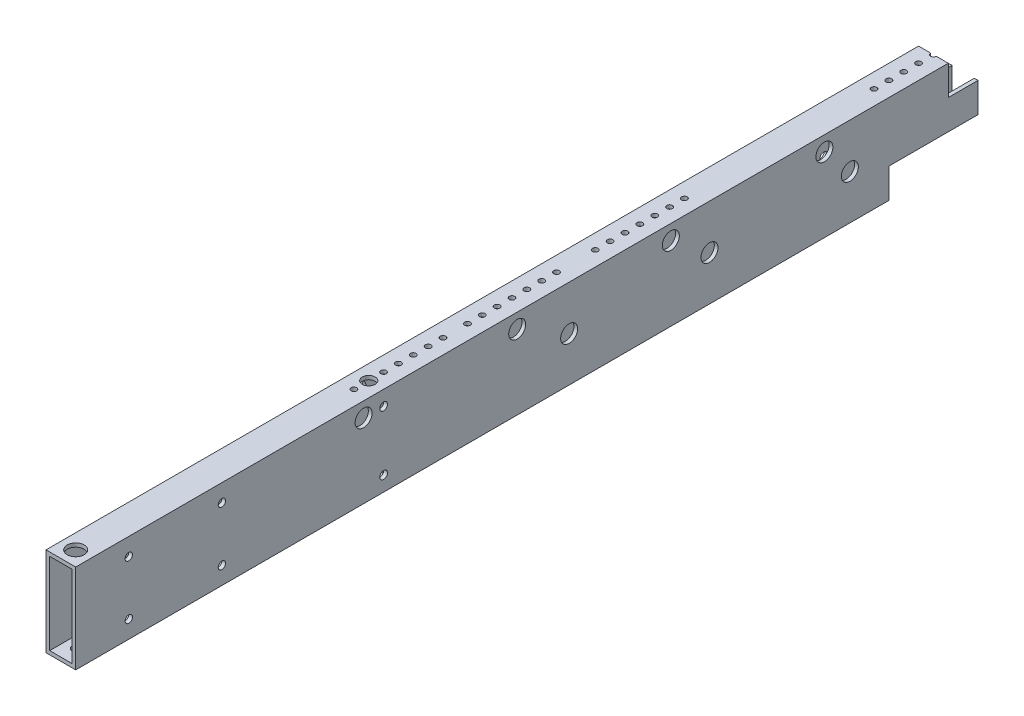
from build123d import *

# Parameters (mm, degrees)
SKETCH1_W                                           = 25.4
SKETCH1_H                                           = 76.2
BOSS_EXTRUDE1_DEPTH                                 = 385.699
SHELL1_T                                            = -3.175
SKETCH2_W                                           = 76.2
SKETCH2_H                                           = 25.4
CUT_EXTRUDE1_DEPTH                                  = 389.407632007
SKETCH3_W                                           = 25.4
SKETCH3_H                                           = 25.4
CUT_EXTRUDE2_DEPTH                                  = 389.407632007
SKETCH4_R                                           = 2.38125
CUT_EXTRUDE3_DEPTH                                  = 394.359185225
CUT_EXTRUDE4_REACH                                  = 395.359
SKETCH5_R                                           = 2.38125
CUT_EXTRUDE5_REACH                                  = 395.359
SKETCH6_R                                           = 2.38125
CBORE_FOR_M6_HEX_HEAD_BOLT1_D                       = 6.3
CBORE_FOR_M6_HEX_HEAD_BOLT1_CBORE_D                 = 14.547
CBORE_FOR_M6_HEX_HEAD_BOLT1_CBORE_DEPTH             = 4
CBORE_FOR_M6_HEX_HEAD_CAP_SCREW1_D                  = 6.6
CBORE_FOR_M6_HEX_HEAD_CAP_SCREW1_CBORE_D            = 14.55
CBORE_FOR_M6_HEX_HEAD_CAP_SCREW1_CBORE_DEPTH        = 4.15
CBORE_FOR_M6_HEX_HEAD_CAP_SCREW2_D                  = 6.6
CBORE_FOR_M6_HEX_HEAD_CAP_SCREW2_CBORE_D            = 14.55
CBORE_FOR_M6_HEX_HEAD_CAP_SCREW2_CBORE_DEPTH        = 4.15
CBORE_FOR_M6_HEX_HEAD_CAP_SCREW3_D                  = 6.6
CBORE_FOR_M6_HEX_HEAD_CAP_SCREW3_CBORE_D            = 14.55
CBORE_FOR_M6_HEX_HEAD_CAP_SCREW3_CBORE_DEPTH        = 4.15
CBORE_FOR_M6_HEX_HEAD_BOLT2_D                       = 6.3
CBORE_FOR_M6_HEX_HEAD_BOLT2_CBORE_D                 = 14.547
CBORE_FOR_M6_HEX_HEAD_BOLT2_CBORE_DEPTH             = 4
CBORE_FOR_M6_HEX_SOCKET_HEAD_CAP_SCREW1_D           = 6.4
CBORE_FOR_M6_HEX_SOCKET_HEAD_CAP_SCREW1_CBORE_D     = 11
CBORE_FOR_M6_HEX_SOCKET_HEAD_CAP_SCREW1_CBORE_DEPTH = 7


with BuildPart() as part:
    # Sketch1 → Boss-Extrude1 (new, symmetric)
    with BuildSketch(Plane.XY):
        Rectangle(SKETCH1_W, SKETCH1_H)
    extrude(amount=BOSS_EXTRUDE1_DEPTH, both=True)

    # Shell1
    shell1_openings = [part.faces().sort_by_distance(p)[0] for p in [
        (0, 0, -385.699),
        (0, 0, 385.699),
    ]]
    offset(amount=SHELL1_T, openings=shell1_openings, kind=Kind.INTERSECTION)

    # Sketch2 → Cut-Extrude1 (cut, through all)
    with BuildSketch(Plane(origin=(12.7, 0, 0), x_dir=(0, 0, -1), z_dir=(1, 0, 0))):
        with Locations((347.599, -25.4)):
            Rectangle(SKETCH2_W, SKETCH2_H)
    extrude(amount=-CUT_EXTRUDE1_DEPTH, mode=Mode.SUBTRACT)

    # Sketch3 → Cut-Extrude2 (cut, through all)
    with BuildSketch(Plane(origin=(12.7, 0, 0), x_dir=(0, 0, -1), z_dir=(1, 0, 0))):
        with Locations((372.999, 25.4)):
            Rectangle(SKETCH3_W, SKETCH3_H)
    extrude(amount=-CUT_EXTRUDE2_DEPTH, mode=Mode.SUBTRACT)

    # Sketch4 → Cut-Extrude3 (cut, through all)
    with BuildSketch(Plane(origin=(0, 38.1, 0), x_dir=(1, 0, 0), z_dir=(0, 1, 0))):
        with Locations((0, 147.394483214)):
            Circle(SKETCH4_R)
        with Locations((0, 134.694483214)):
            Circle(SKETCH4_R)
        with Locations((0, 121.994483214)):
            Circle(SKETCH4_R)
        with Locations((0, 109.294483214)):
            Circle(SKETCH4_R)
        with Locations((0, 96.594483214)):
            Circle(SKETCH4_R)
        with Locations((0, 83.894483214)):
            Circle(SKETCH4_R)
        with Locations((0, 71.194483214)):
            Circle(SKETCH4_R)
        with Locations((0, 38.09873)):
            Circle(SKETCH4_R)
        with Locations((0, 25.39873)):
            Circle(SKETCH4_R)
        with Locations((0, 12.69873)):
            Circle(SKETCH4_R)
        with Locations((0, -0.00127)):
            Circle(SKETCH4_R)
        with Locations((0, -12.70127)):
            Circle(SKETCH4_R)
        with Locations((0, -25.40127)):
            Circle(SKETCH4_R)
        with Locations((0, -38.10127)):
            Circle(SKETCH4_R)
        with Locations((0, -58.99324371)):
            Circle(SKETCH4_R)
        with Locations((0, -71.69324371)):
            Circle(SKETCH4_R)
        with Locations((0, -84.39324371)):
            Circle(SKETCH4_R)
        with Locations((0, -97.09324371)):
            Circle(SKETCH4_R)
        with Locations((0, -109.79324371)):
            Circle(SKETCH4_R)
        with Locations((0, -122.49324371)):
            Circle(SKETCH4_R)
        with Locations((0, -135.19324371)):
            Circle(SKETCH4_R)
    extrude(amount=-CUT_EXTRUDE3_DEPTH, mode=Mode.SUBTRACT)

    # Sketch5 → Cut-Extrude4 (cut, up to next)
    with BuildSketch(Plane(origin=(0, 38.1, 0), x_dir=(1, 0, 0), z_dir=(0, 1, 0)), mode=Mode.PRIVATE) as cut_extrude4_sk1:
        with Locations((0, 360.299)):
            Circle(SKETCH5_R)
    cut_extrude4_tool1 = extrude(cut_extrude4_sk1.sketch, amount=-CUT_EXTRUDE4_REACH, mode=Mode.PRIVATE) & part.part
    # Sketch5 → Cut-Extrude4 (cut, up to next)
    with BuildSketch(Plane(origin=(0, 38.1, 0), x_dir=(1, 0, 0), z_dir=(0, 1, 0)), mode=Mode.PRIVATE) as cut_extrude4_sk2:
        with Locations((0, 347.599)):
            Circle(SKETCH5_R)
    cut_extrude4_tool2 = extrude(cut_extrude4_sk2.sketch, amount=-CUT_EXTRUDE4_REACH, mode=Mode.PRIVATE) & part.part
    # Sketch5 → Cut-Extrude4 (cut, up to next)
    with BuildSketch(Plane(origin=(0, 38.1, 0), x_dir=(1, 0, 0), z_dir=(0, 1, 0)), mode=Mode.PRIVATE) as cut_extrude4_sk3:
        with Locations((0, 334.899)):
            Circle(SKETCH5_R)
    cut_extrude4_tool3 = extrude(cut_extrude4_sk3.sketch, amount=-CUT_EXTRUDE4_REACH, mode=Mode.PRIVATE) & part.part
    # Sketch5 → Cut-Extrude4 (cut, up to next)
    with BuildSketch(Plane(origin=(0, 38.1, 0), x_dir=(1, 0, 0), z_dir=(0, 1, 0)), mode=Mode.PRIVATE) as cut_extrude4_sk4:
        with Locations((0, 322.199)):
            Circle(SKETCH5_R)
    cut_extrude4_tool4 = extrude(cut_extrude4_sk4.sketch, amount=-CUT_EXTRUDE4_REACH, mode=Mode.PRIVATE) & part.part
    # Sketch5 → Cut-Extrude4 (cut, up to next)
    with BuildSketch(Plane(origin=(0, 38.1, 0), x_dir=(1, 0, 0), z_dir=(0, 1, 0)), mode=Mode.PRIVATE) as cut_extrude4_sk5:
        with Locations((0, 309.499)):
            Circle(SKETCH5_R)
    cut_extrude4_tool5 = extrude(cut_extrude4_sk5.sketch, amount=-CUT_EXTRUDE4_REACH, mode=Mode.PRIVATE) & part.part
    add(cut_extrude4_tool1.solids().sort_by_distance((0, 38.1, -360.299))[0], mode=Mode.SUBTRACT)
    add(cut_extrude4_tool2.solids().sort_by_distance((0, 38.1, -347.599))[0], mode=Mode.SUBTRACT)
    add(cut_extrude4_tool3.solids().sort_by_distance((0, 38.1, -334.899))[0], mode=Mode.SUBTRACT)
    add(cut_extrude4_tool4.solids().sort_by_distance((0, 38.1, -322.199))[0], mode=Mode.SUBTRACT)
    add(cut_extrude4_tool5.solids().sort_by_distance((0, 38.1, -309.499))[0], mode=Mode.SUBTRACT)

    # Sketch6 → Cut-Extrude5 (cut, up to next)
    with BuildSketch(Plane.XZ.offset(38.1), mode=Mode.PRIVATE) as cut_extrude5_sk1:
        with Locations((0, -309.499)):
            Circle(SKETCH6_R)
    cut_extrude5_tool1 = extrude(cut_extrude5_sk1.sketch, amount=-CUT_EXTRUDE5_REACH, mode=Mode.PRIVATE) & part.part
    # Sketch6 → Cut-Extrude5 (cut, up to next)
    with BuildSketch(Plane.XZ.offset(38.1), mode=Mode.PRIVATE) as cut_extrude5_sk2:
        with Locations((0, -296.799)):
            Circle(SKETCH6_R)
    cut_extrude5_tool2 = extrude(cut_extrude5_sk2.sketch, amount=-CUT_EXTRUDE5_REACH, mode=Mode.PRIVATE) & part.part
    # Sketch6 → Cut-Extrude5 (cut, up to next)
    with BuildSketch(Plane.XZ.offset(38.1), mode=Mode.PRIVATE) as cut_extrude5_sk3:
        with Locations((0, -284.099)):
            Circle(SKETCH6_R)
    cut_extrude5_tool3 = extrude(cut_extrude5_sk3.sketch, amount=-CUT_EXTRUDE5_REACH, mode=Mode.PRIVATE) & part.part
    # Sketch6 → Cut-Extrude5 (cut, up to next)
    with BuildSketch(Plane.XZ.offset(38.1), mode=Mode.PRIVATE) as cut_extrude5_sk4:
        with Locations((0, -258.699)):
            Circle(SKETCH6_R)
    cut_extrude5_tool4 = extrude(cut_extrude5_sk4.sketch, amount=-CUT_EXTRUDE5_REACH, mode=Mode.PRIVATE) & part.part
    # Sketch6 → Cut-Extrude5 (cut, up to next)
    with BuildSketch(Plane.XZ.offset(38.1), mode=Mode.PRIVATE) as cut_extrude5_sk5:
        with Locations((0, -271.399)):
            Circle(SKETCH6_R)
    cut_extrude5_tool5 = extrude(cut_extrude5_sk5.sketch, amount=-CUT_EXTRUDE5_REACH, mode=Mode.PRIVATE) & part.part
    add(cut_extrude5_tool1.solids().sort_by_distance((0, -38.1, -309.499))[0], mode=Mode.SUBTRACT)
    add(cut_extrude5_tool2.solids().sort_by_distance((0, -38.1, -296.799))[0], mode=Mode.SUBTRACT)
    add(cut_extrude5_tool3.solids().sort_by_distance((0, -38.1, -284.099))[0], mode=Mode.SUBTRACT)
    add(cut_extrude5_tool4.solids().sort_by_distance((0, -38.1, -258.699))[0], mode=Mode.SUBTRACT)
    add(cut_extrude5_tool5.solids().sort_by_distance((0, -38.1, -271.399))[0], mode=Mode.SUBTRACT)

    # CBORE for M6 Hex Head Bolt1 (through all)
    with Locations(Plane.ZY.offset(12.7)):
        with Locations((260.7244, 23.1254), (260.7244, -23.1), (340.3244, 23.1254), (340.3244, -23.1)):
            CounterBoreHole(CBORE_FOR_M6_HEX_HEAD_BOLT1_D / 2, CBORE_FOR_M6_HEX_HEAD_BOLT1_CBORE_D / 2, CBORE_FOR_M6_HEX_HEAD_BOLT1_CBORE_DEPTH)

    # CBORE for M6 Hex Head Cap Screw1 (through all)
    with Locations(Plane.ZY.offset(12.7)):
        with Locations((122.46784244, 25.4), (122.46784244, -25.4)):
            CounterBoreHole(CBORE_FOR_M6_HEX_HEAD_CAP_SCREW1_D / 2, CBORE_FOR_M6_HEX_HEAD_CAP_SCREW1_CBORE_D / 2, CBORE_FOR_M6_HEX_HEAD_CAP_SCREW1_CBORE_DEPTH)

    # CBORE for M6 Hex Head Cap Screw2 (through all)
    with Locations(Plane(origin=(0, 38.1, 0), x_dir=(1, 0, 0), z_dir=(0, 1, 0))):
        with Locations((0, -372.999)):
            CounterBoreHole(CBORE_FOR_M6_HEX_HEAD_CAP_SCREW2_D / 2, CBORE_FOR_M6_HEX_HEAD_CAP_SCREW2_CBORE_D / 2, CBORE_FOR_M6_HEX_HEAD_CAP_SCREW2_CBORE_DEPTH)

    # CBORE for M6 Hex Head Cap Screw3 (through all)
    with Locations(Plane(origin=(12.7, 0, 0), x_dir=(0, 0, -1), z_dir=(1, 0, 0))):
        with Locations((36.144871949, 0), (156.144871949, 0), (276.144871949, 0)):
            CounterBoreHole(CBORE_FOR_M6_HEX_HEAD_CAP_SCREW3_D / 2, CBORE_FOR_M6_HEX_HEAD_CAP_SCREW3_CBORE_D / 2, CBORE_FOR_M6_HEX_HEAD_CAP_SCREW3_CBORE_DEPTH)

    # CBORE for M6 Hex Head Bolt2 (through all)
    with Locations(Plane(origin=(12.7, 0, 0), x_dir=(0, 0, -1), z_dir=(1, 0, 0))):
        with Locations((254.381, 25.4), (123.063, 25.4), (-8.255, 25.4), (-139.573, 25.4)):
            CounterBoreHole(CBORE_FOR_M6_HEX_HEAD_BOLT2_D / 2, CBORE_FOR_M6_HEX_HEAD_BOLT2_CBORE_D / 2, CBORE_FOR_M6_HEX_HEAD_BOLT2_CBORE_DEPTH)

    # CBORE for M6 Hex Socket Head Cap Screw1 (through all)
    with Locations(Plane(origin=(0, 38.1, 0), x_dir=(1, 0, 0), z_dir=(0, 1, 0))):
        with Locations((0, -122.49324371)):
            CounterBoreHole(CBORE_FOR_M6_HEX_SOCKET_HEAD_CAP_SCREW1_D / 2, CBORE_FOR_M6_HEX_SOCKET_HEAD_CAP_SCREW1_CBORE_D / 2, CBORE_FOR_M6_HEX_SOCKET_HEAD_CAP_SCREW1_CBORE_DEPTH)


solid = part.part
